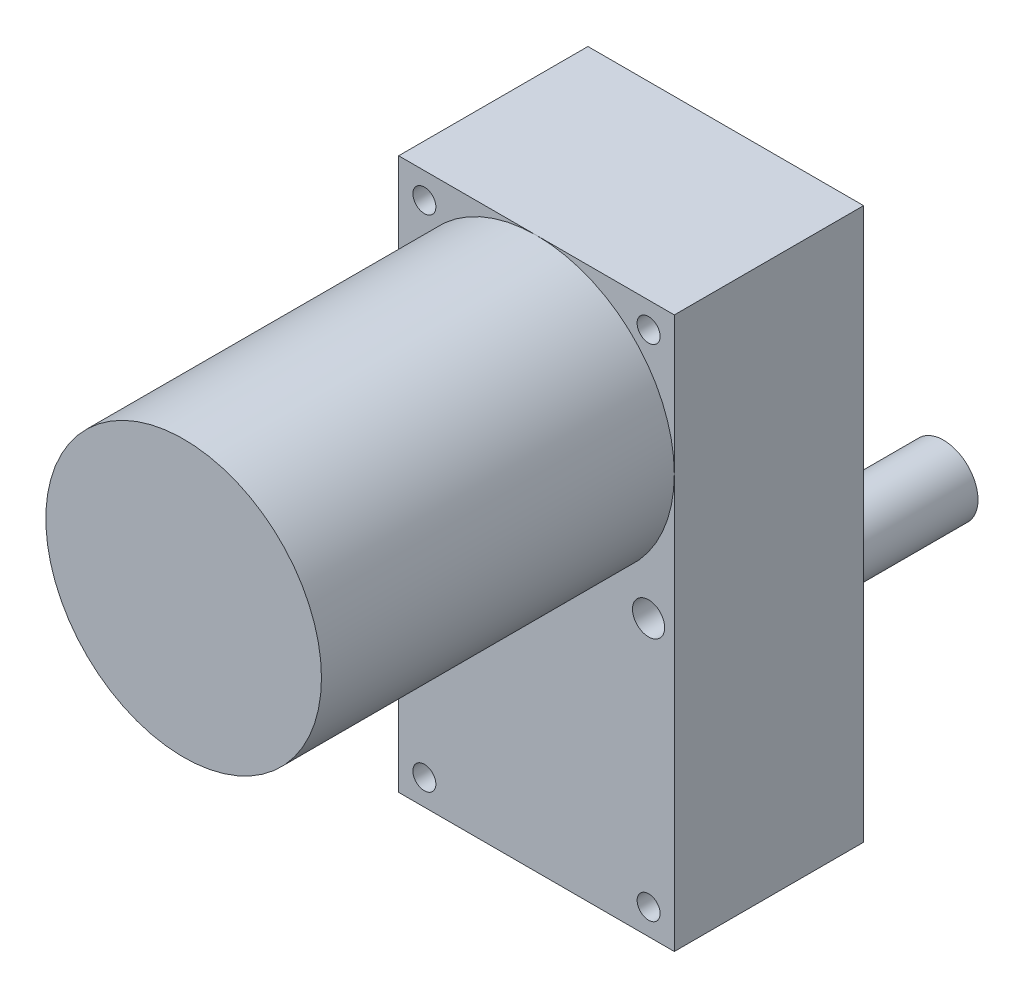
from build123d import *

# Parameters (mm, degrees)
SKETCH1_W           = 76.2
SKETCH1_H           = 152.4
SKETCH1_R           = 3.175
SKETCH1_R_2         = 4.445
BOSS_EXTRUDE1_DEPTH = 52.324
SKETCH1_3_R         = 23.495
SKETCH1_3_R_2       = 9.525
BOSS_EXTRUDE2_DEPTH = 4.826
SKETCH1_5_R         = 9.525
SKETCH1_5_R_2       = 3.96875
BOSS_EXTRUDE3_DEPTH = 60.198
CUT_EXTRUDE1_START  = -26.924
CUT_EXTRUDE1_DEPTH  = 26.924
SKETCH4_R           = 38.1
BOSS_EXTRUDE4_DEPTH = 97.536


with BuildPart() as part:
    # Sketch1 → Boss-Extrude1 (new body)
    with BuildSketch(Plane.XY):
        Rectangle(SKETCH1_W, SKETCH1_H)
        with Locations((-30.994242086, -69.088)):
            Circle(SKETCH1_R, mode=Mode.SUBTRACT)
        with Locations((-30.988, 0)):
            Circle(SKETCH1_R_2, mode=Mode.SUBTRACT)
        with Locations((30.994242086, -69.088)):
            Circle(SKETCH1_R, mode=Mode.SUBTRACT)
        with Locations((30.988, 0)):
            Circle(SKETCH1_R_2, mode=Mode.SUBTRACT)
        with Locations((-30.988, 69.088)):
            Circle(SKETCH1_R, mode=Mode.SUBTRACT)
        with Locations((30.988, 69.088)):
            Circle(SKETCH1_R, mode=Mode.SUBTRACT)
    extrude(amount=BOSS_EXTRUDE1_DEPTH)

    # Sketch1<3> → Boss-Extrude2 (add)
    # profile 1 of 2: a face of its own
    with BuildSketch(Plane.XY):
        with Locations((0, 38.608)):
            Circle(SKETCH1_3_R)
    # profile 2 of 2: a face of its own
    with BuildSketch(Plane.XY):
        with Locations((0, -38.608)):
            Circle(SKETCH1_3_R)
        with Locations((0, -38.608)):
            Circle(SKETCH1_3_R_2, mode=Mode.SUBTRACT)
    extrude(amount=-BOSS_EXTRUDE2_DEPTH)

    # Sketch1<5> → Boss-Extrude3 (add)
    with BuildSketch(Plane.XY):
        with Locations((0, -38.608)):
            Circle(SKETCH1_5_R)
        with Locations((0, -38.608)):
            Circle(SKETCH1_5_R_2, mode=Mode.SUBTRACT)
    extrude(amount=-BOSS_EXTRUDE3_DEPTH)

    # Sketch2 → Cut-Extrude1 (cut)
    with BuildSketch(Plane(origin=(0, 0, -60.198), x_dir=(-1, 0, 0), z_dir=(0, 0, -1)).offset(CUT_EXTRUDE1_START)):
        with BuildLine():
            Line((8.980256121, -35.433), (4.427938354, -35.433))
            Line((4.427938354, -35.433), (4.427938354, -41.783))
            Line((4.427938354, -41.783), (8.980256121, -41.783))
            ThreePointArc((8.980256121, -41.783), (9.525, -38.608), (8.980256121, -35.433))
        make_face()
    extrude(amount=CUT_EXTRUDE1_DEPTH, mode=Mode.SUBTRACT)

    # Sketch4 → Boss-Extrude4 (add)
    with BuildSketch(Plane.XY.offset(52.324)):
        with Locations((0, 38.1)):
            Circle(SKETCH4_R)
    extrude(amount=BOSS_EXTRUDE4_DEPTH)


solid = part.part
